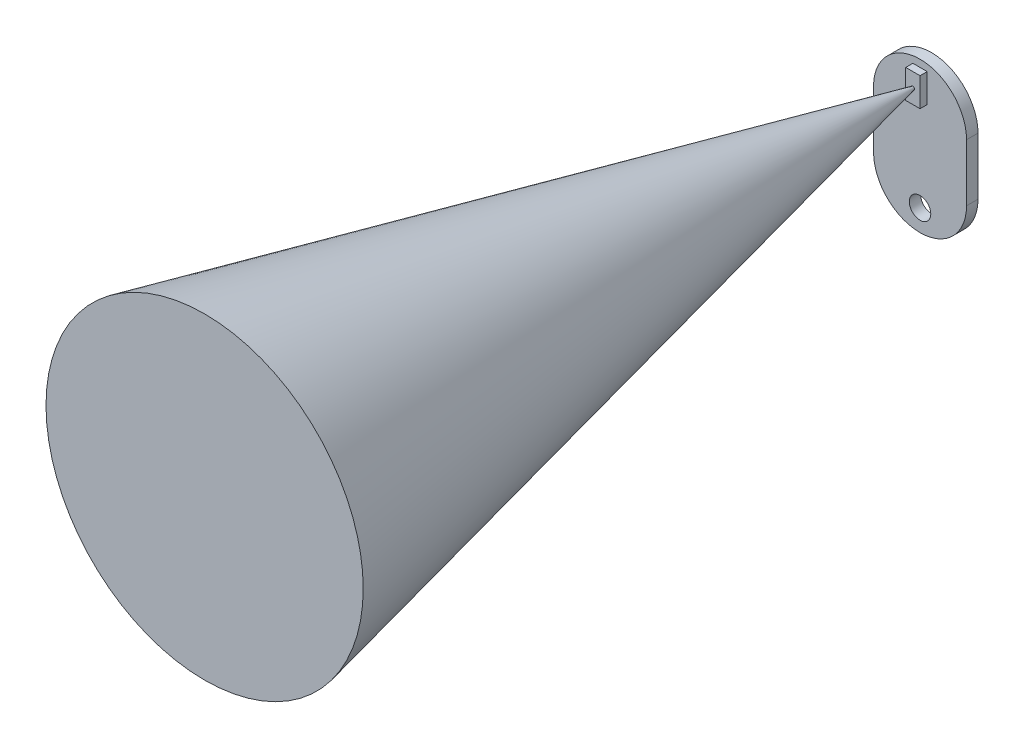
from build123d import *

# Parameters (mm, degrees)
ESQUISSE1_R        = 1.5
BOSS_EXTRU_1_DEPTH = 1.6
ESQUISSE2_W        = 2
ESQUISSE2_H        = 4
BOSS_EXTRU_2_DEPTH = 1


with BuildPart() as part:
    # Esquisse1 → Boss.-Extru.1 (new body)
    with BuildSketch(Plane.XY):
        with BuildLine():
            Line((6.5, -3.5), (6.5, -11.5))
            ThreePointArc((6.5, -11.5), (0, -18), (-6.5, -11.5))
            Line((-6.5, -11.5), (-6.5, -3.5))
            ThreePointArc((-6.5, -3.5), (0, 3), (6.5, -3.5))
        make_face()
        with Locations((0, -15)):
            Circle(ESQUISSE1_R, mode=Mode.SUBTRACT)
    extrude(amount=BOSS_EXTRU_1_DEPTH)

    # Esquisse2 → Boss.-Extru.2 (add)
    with BuildSketch(Plane.XY.offset(1.6)):
        Rectangle(ESQUISSE2_W, ESQUISSE2_H)
    extrude(amount=BOSS_EXTRU_2_DEPTH)

    # Esquisse3 → Révolution1 (revolve)
    with BuildSketch(Plane(origin=(0, 0, 0), x_dir=(0, 0, -1), z_dir=(1, 0, 0))):
        Polygon((-1.6, 0), (-101.6, 0), (-101.6, 22.169466264), align=None)
    revolve(axis=Axis((0, 0, 0), (0, 0, 1)))


solid = part.part
